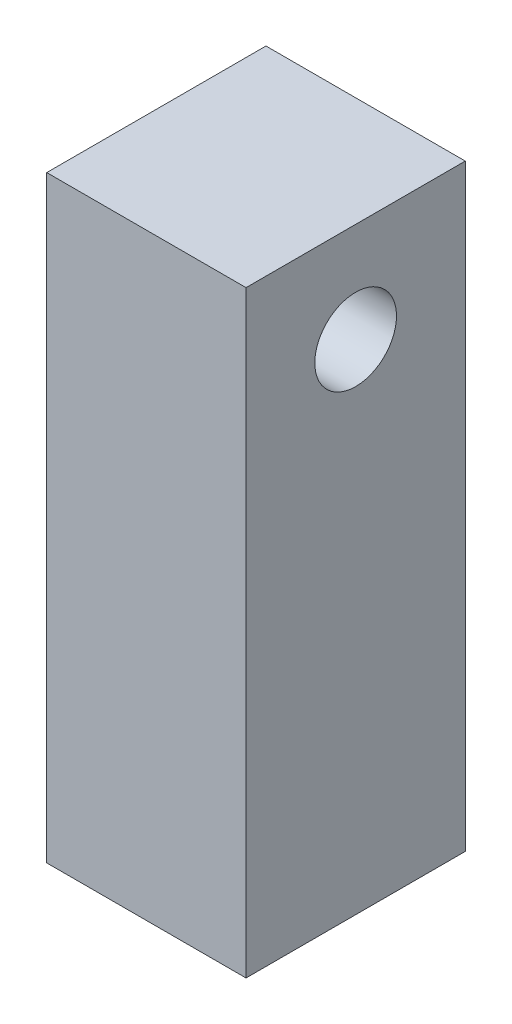
from build123d import *

# Parameters (mm, degrees)
SKETCH1_W               = 50
SKETCH1_H               = 150
BOSS_EXTRUDE1_DEPTH     = 55
CUT_EXTRUDE1_DEPTH      = 168.406690428
CUT_EXTRUDE1_DEPTH_BACK = 45
SKETCH2_R               = 10.25
SKETCH7_R               = 1
SKETCH7_R_2             = 4.25
CUT_EXTRUDE3_DEPTH      = 10


with BuildPart() as part:
    # Sketch1 → Boss-Extrude1 (new body)
    with BuildSketch(Plane.XY):
        with Locations((0, -75)):
            Rectangle(SKETCH1_W, SKETCH1_H)
    extrude(amount=-BOSS_EXTRUDE1_DEPTH)

    # Sketch2 → Cut-Extrude1 (cut, two sides: drawn at the far end of the back side and taken through both)
    with BuildSketch(Plane(origin=(25, 0, 0), x_dir=(0, 0, -1), z_dir=(1, 0, 0)).offset(-CUT_EXTRUDE1_DEPTH_BACK)):
        with Locations((27.5, -25)):
            Circle(SKETCH2_R)
    extrude(amount=CUT_EXTRUDE1_DEPTH + CUT_EXTRUDE1_DEPTH_BACK, mode=Mode.SUBTRACT)

    # Sketch7 → Cut-Extrude3 (cut)
    with BuildSketch(Plane(origin=(-20, 0, 0), x_dir=(0, 0, -1), z_dir=(1, 0, 0))):
        with Locations((27.5, -17)):
            Circle(SKETCH7_R)
        with Locations((27.5, -25)):
            Circle(SKETCH7_R_2)
        with Locations((35.5, -25)):
            Circle(SKETCH7_R)
        with Locations((19.5, -25)):
            Circle(SKETCH7_R)
        with Locations((27.5, -33)):
            Circle(SKETCH7_R)
    extrude(amount=-CUT_EXTRUDE3_DEPTH, mode=Mode.SUBTRACT)


solid = part.part
